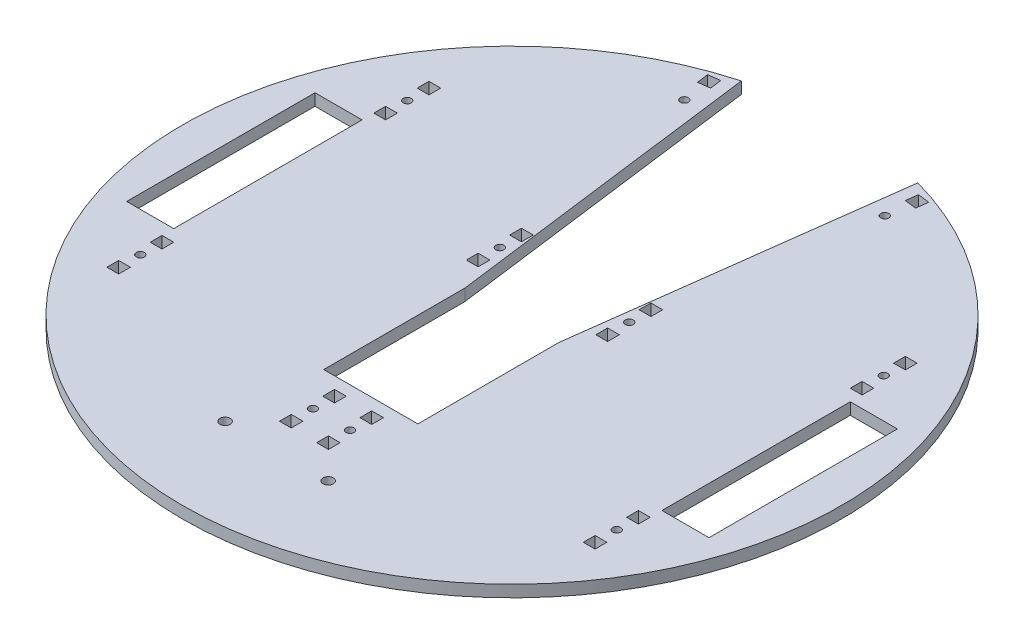
from build123d import *

# Parameters (mm, degrees)
BOTTOM_PLATE_R      = 2.794
BOTTOM_PLATE_W      = 6.35
BOTTOM_PLATE_H      = 6.35
BOTTOM_PLATE_R_2    = 2.159
BOTTOM_PLATE_W_2    = 25.4
BOTTOM_PLATE_H_2    = 101.6
BOSS_EXTRUDE1_DEPTH = 6.35


with BuildPart() as part:
    # Bottom Plate → Boss-Extrude1 (new body)
    with BuildSketch(Plane(origin=(0, 0, 0), x_dir=(1, 0, 0), z_dir=(0, 1, 0))):
        with BuildLine():
            Line((47.625, 171.302946195), (25.4, 0))
            Line((25.4, 0), (25.4, -76.2))
            Line((25.4, -76.2), (-25.4, -76.2))
            Line((-25.4, -76.2), (-25.4, 0))
            Line((-25.4, 0), (-47.625, 171.302946195))
            ThreePointArc((-47.625, 171.302946195), (0, -177.8), (47.625, 171.302946195))
        make_face()
        with Locations((-27.813, -127)):
            Circle(BOTTOM_PLATE_R, mode=Mode.SUBTRACT)
        with Locations((-10.033, -109.093)):
            Rectangle(BOTTOM_PLATE_W, BOTTOM_PLATE_H, mode=Mode.SUBTRACT)
        with Locations((-10.033, -97.409)):
            Circle(BOTTOM_PLATE_R_2, mode=Mode.SUBTRACT)
        with Locations((-128.515324336, -83.693)):
            Rectangle(BOTTOM_PLATE_W, BOTTOM_PLATE_H, mode=Mode.SUBTRACT)
        with Locations((-128.515324336, -72.009)):
            Circle(BOTTOM_PLATE_R_2, mode=Mode.SUBTRACT)
        with Locations((-128.515324336, -60.325)):
            Rectangle(BOTTOM_PLATE_W, BOTTOM_PLATE_H, mode=Mode.SUBTRACT)
        with Locations((-10.033, -85.725)):
            Rectangle(BOTTOM_PLATE_W, BOTTOM_PLATE_H, mode=Mode.SUBTRACT)
        with Locations((27.813, -127)):
            Circle(BOTTOM_PLATE_R, mode=Mode.SUBTRACT)
        with Locations((10.033, -109.093)):
            Rectangle(BOTTOM_PLATE_W, BOTTOM_PLATE_H, mode=Mode.SUBTRACT)
        with Locations((10.033, -97.409)):
            Circle(BOTTOM_PLATE_R_2, mode=Mode.SUBTRACT)
        with Locations((10.033, -85.725)):
            Rectangle(BOTTOM_PLATE_W, BOTTOM_PLATE_H, mode=Mode.SUBTRACT)
        with Locations((128.515324336, -83.693)):
            Rectangle(BOTTOM_PLATE_W, BOTTOM_PLATE_H, mode=Mode.SUBTRACT)
        with Locations((128.515324336, -72.009)):
            Circle(BOTTOM_PLATE_R_2, mode=Mode.SUBTRACT)
        with Locations((128.515324336, -60.325)):
            Rectangle(BOTTOM_PLATE_W, BOTTOM_PLATE_H, mode=Mode.SUBTRACT)
        with Locations((-144.390324336, 0)):
            Rectangle(BOTTOM_PLATE_W_2, BOTTOM_PLATE_H_2, mode=Mode.SUBTRACT)
        with Locations((-128.515324336, 60.325)):
            Rectangle(BOTTOM_PLATE_W, BOTTOM_PLATE_H, mode=Mode.SUBTRACT)
        with Locations((-128.515324336, 72.009)):
            Circle(BOTTOM_PLATE_R_2, mode=Mode.SUBTRACT)
        with Locations((-128.515324336, 83.693)):
            Rectangle(BOTTOM_PLATE_W, BOTTOM_PLATE_H, mode=Mode.SUBTRACT)
        with Locations((-34.925, 16.637)):
            Rectangle(BOTTOM_PLATE_W, BOTTOM_PLATE_H, mode=Mode.SUBTRACT)
        with Locations((-34.925, 28.321)):
            Circle(BOTTOM_PLATE_R_2, mode=Mode.SUBTRACT)
        with Locations((-34.925, 40.005)):
            Rectangle(BOTTOM_PLATE_W, BOTTOM_PLATE_H, mode=Mode.SUBTRACT)
        with Locations((-54.082553747, 147.04477289)):
            Circle(BOTTOM_PLATE_R_2, mode=Mode.SUBTRACT)
        Polygon((-52.518937038, 159.669886307), (-58.816158581, 158.852879058), (-59.63316583, 165.1501006), (-53.335944287, 165.967107849), align=None, mode=Mode.SUBTRACT)
        with Locations((34.925, 16.637)):
            Rectangle(BOTTOM_PLATE_W, BOTTOM_PLATE_H, mode=Mode.SUBTRACT)
        with Locations((34.925, 28.321)):
            Circle(BOTTOM_PLATE_R_2, mode=Mode.SUBTRACT)
        with Locations((34.925, 40.005)):
            Rectangle(BOTTOM_PLATE_W, BOTTOM_PLATE_H, mode=Mode.SUBTRACT)
        with Locations((144.390324336, 0)):
            Rectangle(BOTTOM_PLATE_W_2, BOTTOM_PLATE_H_2, mode=Mode.SUBTRACT)
        with Locations((128.515324336, 60.325)):
            Rectangle(BOTTOM_PLATE_W, BOTTOM_PLATE_H, mode=Mode.SUBTRACT)
        with Locations((128.515324336, 72.009)):
            Circle(BOTTOM_PLATE_R_2, mode=Mode.SUBTRACT)
        with Locations((128.515324336, 83.693)):
            Rectangle(BOTTOM_PLATE_W, BOTTOM_PLATE_H, mode=Mode.SUBTRACT)
        with Locations((54.082553747, 147.04477289)):
            Circle(BOTTOM_PLATE_R_2, mode=Mode.SUBTRACT)
        Polygon((58.816158581, 158.852879058), (52.518937038, 159.669886307), (53.335944287, 165.967107849), (59.63316583, 165.1501006), align=None, mode=Mode.SUBTRACT)
    extrude(amount=-BOSS_EXTRUDE1_DEPTH)


solid = part.part
